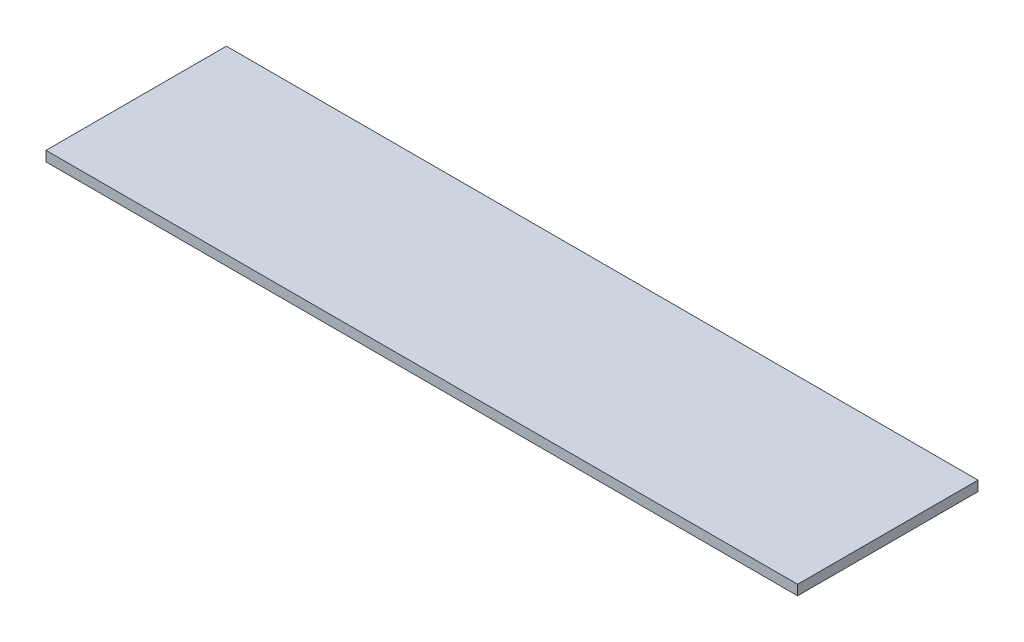
from build123d import *

# Parameters (mm, degrees)
ESBO_O1_W          = 36
ESBO_O1_H          = 2
FLANGE_BASE2_DEPTH = 75


# Sheet-metal steps are written as plain solids
with BuildPart() as part:
    # Esboço1 → Flange-base2 (new, symmetric)
    with BuildSketch(Plane(origin=(0, 0, 0), x_dir=(0, 0, -1), z_dir=(1, 0, 0))):
        with Locations((0, -1)):
            Rectangle(ESBO_O1_W, ESBO_O1_H)
    extrude(amount=FLANGE_BASE2_DEPTH, both=True)


solid = part.part
